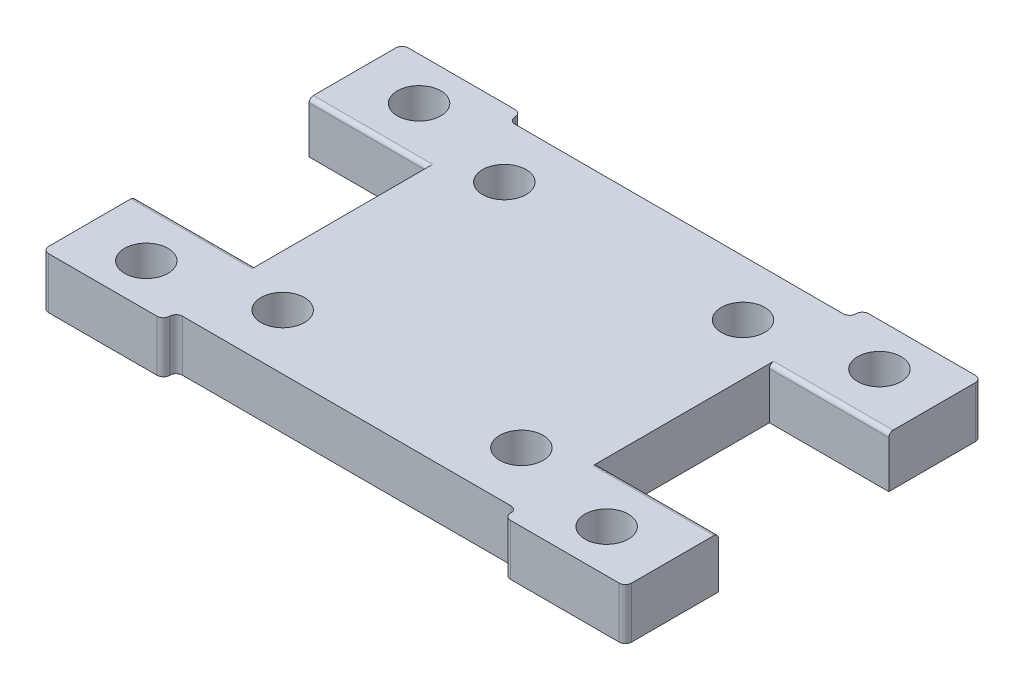
from build123d import *

# Parameters (mm, degrees)
SKETCH1_R           = 2.55
BOSS_EXTRUDE1_DEPTH = 6
FILLET1_R           = 0.74
FILLET2_R           = 0.5


with BuildPart() as part:
    # Sketch1 → Boss-Extrude1 (new body)
    with BuildSketch(Plane(origin=(0, 0, 0), x_dir=(1, 0, 0), z_dir=(0, 1, 0))):
        with BuildLine():
            Line((-19.26, -19.5), (19.26, -19.5))
            ThreePointArc((19.26, -19.5), (19.783259018, -19.716740982), (20, -20.24))
            Line((20, -20.24), (20, -20.26))
            ThreePointArc((20, -20.26), (20.216740982, -20.783259018), (20.74, -21))
            Line((20.74, -21), (34.2, -21))
            Line((34.2, -21), (34.2, -10.099009877))
            Line((34.2, -10.099009877), (20, -10.099009877))
            Line((20, -10.099009877), (20, 10.1))
            Line((20, 10.1), (34, 10.1))
            Line((34, 10.1), (34, 21))
            Line((34, 21), (20.74, 21))
            ThreePointArc((20.74, 21), (20.216740982, 20.783259018), (20, 20.26))
            Line((20, 20.26), (20, 20.24))
            ThreePointArc((20, 20.24), (19.783259018, 19.716740982), (19.26, 19.5))
            Line((19.26, 19.5), (-19.26, 19.5))
            ThreePointArc((-19.26, 19.5), (-19.783259018, 19.716740982), (-20, 20.24))
            Line((-20, 20.24), (-20, 20.26))
            ThreePointArc((-20, 20.26), (-20.216740982, 20.783259018), (-20.74, 21))
            Line((-20.74, 21), (-34, 21))
            Line((-34, 21), (-34, 10.1))
            Line((-34, 10.1), (-20, 10.1))
            Line((-20, 10.1), (-20, -10.099009877))
            Line((-20, -10.099009877), (-34.2, -10.099009877))
            Line((-34.2, -10.099009877), (-34.2, -21))
            Line((-34.2, -21), (-20.74, -21))
            ThreePointArc((-20.74, -21), (-20.216740982, -20.783259018), (-20, -20.26))
            Line((-20, -20.26), (-20, -20.24))
            ThreePointArc((-20, -20.24), (-19.783259018, -19.716740982), (-19.26, -19.5))
        make_face()
        with Locations((-14, 13)):
            Circle(SKETCH1_R, mode=Mode.SUBTRACT)
        with Locations((14, 13)):
            Circle(SKETCH1_R, mode=Mode.SUBTRACT)
        with Locations((14, -13)):
            Circle(SKETCH1_R, mode=Mode.SUBTRACT)
        with Locations((-14, -13)):
            Circle(SKETCH1_R, mode=Mode.SUBTRACT)
        with Locations((27, 16)):
            Circle(SKETCH1_R, mode=Mode.SUBTRACT)
        with Locations((27, -16)):
            Circle(SKETCH1_R, mode=Mode.SUBTRACT)
        with Locations((-27, -16)):
            Circle(SKETCH1_R, mode=Mode.SUBTRACT)
        with Locations((-27, 16)):
            Circle(SKETCH1_R, mode=Mode.SUBTRACT)
    extrude(amount=BOSS_EXTRUDE1_DEPTH)

    # Fillet1
    fillet1_edges = [part.edges().sort_by_distance(p)[0] for p in [
        (-34, 3, -21),
        (-34.2, 3, 21),
        (34.2, 3, 21),
        (34, 3, -21),
    ]]
    fillet(fillet1_edges, radius=FILLET1_R)

    # Fillet2
    fillet2_edges = [part.edges().sort_by_distance(p)[0] for p in [
        (-27, 6, -10.1),
        (-27.1, 6, 10.099009877),
        (27, 6, -10.1),
        (27.1, 6, 10.099009877),
    ]]
    fillet(fillet2_edges, radius=FILLET2_R)


solid = part.part
